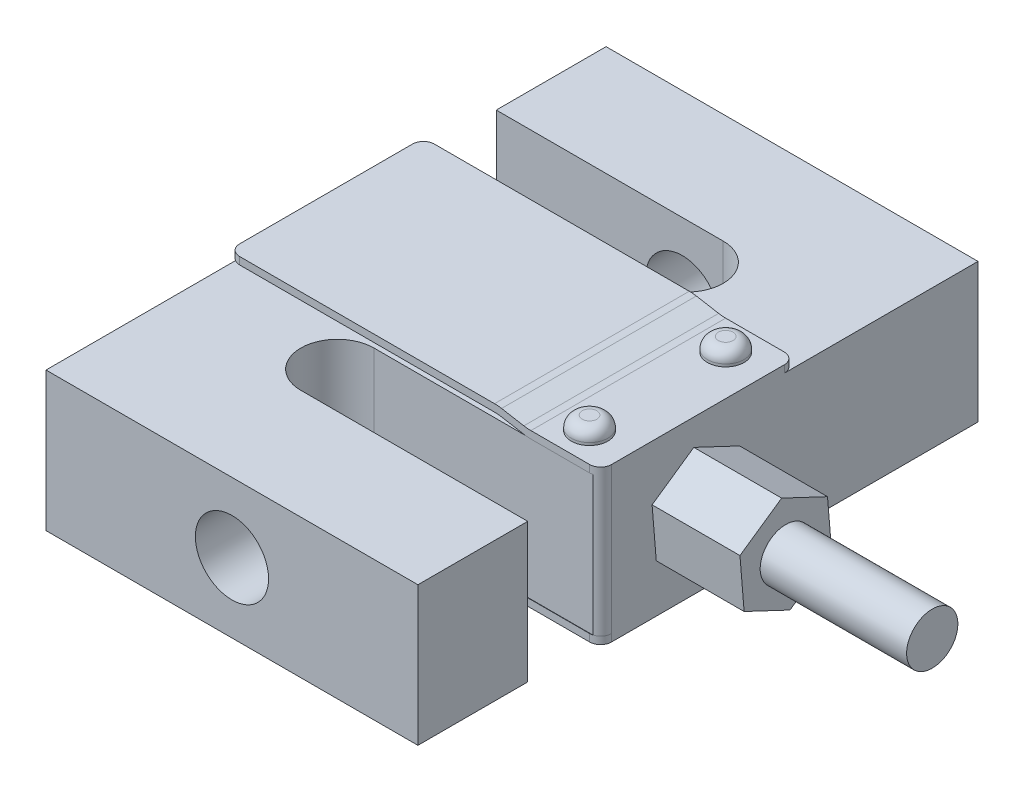
from build123d import *

# Parameters (mm, degrees)
SALIENTE_EXTRUIR1_DEPTH = 19
CORTAR_EXTRUIR1_REACH   = 84.816
CROQUIS2_R              = 5
CORTAR_EXTRUIR2_REACH   = 84.816
CROQUIS3_R              = 5
SALIENTE_EXTRUIR2_DEPTH = 12
CROQUIS5_R              = 3.5
SALIENTE_EXTRUIR3_DEPTH = 20
SALIENTE_EXTRUIR4_DEPTH = 13.3
REDONDEO1_R             = 1.5
CROQUIS8_R              = 2.5
SALIENTE_EXTRUIR5_DEPTH = 1.85
REDONDEO2_R             = 1.5
SIMETR_A1_START         = -1.3500001
SIMETR_A1_OUTLINE_R     = 2.5
SIMETR_A1_DEPTH         = 1.3500001
SIMETR_A1_START_2       = -13.3
SIMETR_A1_2_DEPTH       = 26.6
SIMETR_A1_START_3       = -3
SIMETR_A1_5_DEPTH       = 3


with BuildPart() as part:
    # Croquis1 → Saliente-Extruir1 (new body)
    with BuildSketch(Plane(origin=(0, 0, 0), x_dir=(1, 0, 0), z_dir=(0, 1, 0))):
        with BuildLine():
            Line((-25.4, 23.25), (-25.4, 38.25))
            Line((-25.4, 38.25), (25.4, 38.25))
            Line((25.4, 38.25), (25.4, -13.25))
            Line((25.4, -13.25), (-5.6, -13.25))
            ThreePointArc((-5.6, -13.25), (-10.6, -18.25), (-5.6, -23.25))
            Line((-5.6, -23.25), (25.4, -23.25))
            Line((25.4, -23.25), (25.4, -38.25))
            Line((25.4, -38.25), (-25.4, -38.25))
            Line((-25.4, -38.25), (-25.4, 13.25))
            Line((-25.4, 13.25), (5.6, 13.25))
            ThreePointArc((5.6, 13.25), (10.6, 18.25), (5.6, 23.25))
            Line((5.6, 23.25), (-25.4, 23.25))
        make_face()
    extrude(amount=SALIENTE_EXTRUIR1_DEPTH)

    # Croquis2 → Cortar-Extruir1 (cut, up to next)
    with BuildSketch(Plane(origin=(0, 0, -38.25), x_dir=(-1, 0, 0), z_dir=(0, 0, -1)), mode=Mode.PRIVATE) as cortar_extruir1_sk1:
        with Locations((0, 9.5)):
            Circle(CROQUIS2_R)
    cortar_extruir1_tool1 = extrude(cortar_extruir1_sk1.sketch, amount=-CORTAR_EXTRUIR1_REACH, mode=Mode.PRIVATE) & part.part
    add(cortar_extruir1_tool1.solids().sort_by_distance((0, 9.5, -38.25))[0], mode=Mode.SUBTRACT)

    # Croquis3 → Cortar-Extruir2 (cut, up to next)
    with BuildSketch(Plane.XY.offset(38.25), mode=Mode.PRIVATE) as cortar_extruir2_sk1:
        with Locations(Location((0, 9.5, 0), (0, 0, 180))):
            Circle(CROQUIS3_R)
    cortar_extruir2_tool1 = extrude(cortar_extruir2_sk1.sketch, amount=-CORTAR_EXTRUIR2_REACH, mode=Mode.PRIVATE) & part.part
    add(cortar_extruir2_tool1.solids().sort_by_distance((0, 9.5, 38.25))[0], mode=Mode.SUBTRACT)

    # Croquis4 → Saliente-Extruir2 (add)
    with BuildSketch(Plane(origin=(25.4, 0, 0), x_dir=(0, 0, -1), z_dir=(1, 0, 0))):
        Polygon((0.567837029, 2.595106003), (6.263732126, 6.539314294), (5.695895097, 13.444208291), (-0.567837029, 16.404893997), (-6.263732126, 12.460685706), (-5.695895097, 5.555791709), align=None)
    extrude(amount=SALIENTE_EXTRUIR2_DEPTH)

    # Croquis5 → Saliente-Extruir3 (add)
    with BuildSketch(Plane(origin=(37.4, 0, 0), x_dir=(0, 0, -1), z_dir=(1, 0, 0))):
        with Locations((0, 9.5)):
            Circle(CROQUIS5_R)
    extrude(amount=SALIENTE_EXTRUIR3_DEPTH)

    # Croquis6 → Saliente-Extruir4 (add, symmetric)
    with BuildSketch(Plane.XY):
        with BuildLine():
            Line((25.4, 19), (15.884301947, 19))
            ThreePointArc((15.884301947, 19), (15.401815848, 19.020910233), (14.922947827, 19.08348413))
            Line((14.922947827, 19.08348413), (11.877052173, 19.61651587))
            ThreePointArc((11.877052173, 19.61651587), (11.398184152, 19.679089767), (10.915698053, 19.7))
            Line((10.915698053, 19.7), (-25.4, 19.7))
            Line((-25.4, 19.7), (-25.4, 20.7))
            Line((-25.4, 20.7), (10.915698053, 20.7))
            ThreePointArc((10.915698053, 20.7), (11.398184152, 20.679089767), (11.877052173, 20.61651587))
            Line((11.877052173, 20.61651587), (14.922947827, 20.08348413))
            ThreePointArc((14.922947827, 20.08348413), (15.401815848, 20.020910233), (15.884301947, 20))
            Line((15.884301947, 20), (25.4, 20))
            Line((25.4, 20), (25.4, 19))
        make_face()
    extrude(amount=SALIENTE_EXTRUIR4_DEPTH, both=True)

    # Redondeo1
    redondeo1_edges = [part.edges().sort_by_distance(p)[0] for p in [
        (-25.4, 20.2, -13.3),
        (-25.4, 20.2, 13.3),
        (25.4, 19.5, 13.3),
        (25.4, 19.5, -13.3),
    ]]
    fillet(redondeo1_edges, radius=REDONDEO1_R)

    # Croquis8 → Saliente-Extruir5 (add)
    with BuildSketch(Plane(origin=(0, 20, 0), x_dir=(1, 0, 0), z_dir=(0, 1, 0))):
        with Locations(Location((19.892150974, 9.3, 0), (0, 0, 180))):
            Circle(CROQUIS8_R)
        with Locations(Location((19.892150974, -9.3, 0), (0, 0, 180))):
            Circle(CROQUIS8_R)
    extrude(amount=SALIENTE_EXTRUIR5_DEPTH)

    # Redondeo2
    redondeo2_edges = [part.edges().sort_by_distance(p)[0] for p in [
        (22.392150974, 21.85, -9.3),
        (22.392150974, 21.85, 9.3),
    ]]
    fillet(redondeo2_edges, radius=REDONDEO2_R)

    # Simetría1: read off the stored shape, not the designer's step
    # Simetría1 outline → Simetría1 (add)
    with BuildSketch(Plane(origin=(0, 0, 0), x_dir=(1, 0, 0), z_dir=(0, 1, 0)).offset(SIMETR_A1_START)):
        with Locations((19.892150974, 9.3)):
            Circle(SIMETR_A1_OUTLINE_R)
        with Locations((19.892150974, -9.3)):
            Circle(SIMETR_A1_OUTLINE_R)
    extrude(amount=SIMETR_A1_DEPTH)

    # Simetr_a1 2 outline → Simetr_a1 2 (add)
    with BuildSketch(Plane.XY.offset(SIMETR_A1_START_2)):
        with BuildLine():
            Line((-25.4, -0.7), (-25.4, -1.7))
            Line((-25.4, -1.7), (10.915698053, -1.7))
            ThreePointArc((10.915698053, -1.7), (11.398184152, -1.679089767), (11.877052173, -1.61651587))
            Line((11.877052173, -1.61651587), (14.922947827, -1.08348413))
            ThreePointArc((14.922947827, -1.08348413), (15.401815848, -1.020910233), (15.884301947, -1))
            Line((15.884301947, -1), (25.4, -1))
            Line((25.4, -1), (25.4, 0))
            Line((25.4, 0), (15.884301947, 0))
            ThreePointArc((15.884301947, 0), (15.401815848, -0.020910233), (14.922947827, -0.08348413))
            Line((14.922947827, -0.08348413), (11.877052173, -0.61651587))
            ThreePointArc((11.877052173, -0.61651587), (11.398184152, -0.679089767), (10.915698053, -0.7))
            Line((10.915698053, -0.7), (-25.4, -0.7))
        make_face()
    extrude(amount=SIMETR_A1_2_DEPTH)

    # Simetr_a1 3 outline → Simetr_a1 3 (revolve)
    with BuildSketch(Plane(origin=(19.892150974, 0, -9.3), x_dir=(1, 0, 0), z_dir=(0, 0, 1))):
        with BuildLine():
            Line((0, -1.35), (0, -2.85))
            Line((0, -2.85), (1, -2.85))
            ThreePointArc((1, -2.85), (2.060660172, -2.410660172), (2.5, -1.35))
            Line((2.5, -1.35), (0, -1.35))
        make_face()
    revolve(axis=Axis((19.892150974, 0, -9.3), (0, 1, 0)))

    # Simetr_a1 4 outline → Simetr_a1 4 (revolve)
    with BuildSketch(Plane(origin=(19.892150974, 0, 9.3), x_dir=(1, 0, 0), z_dir=(0, 0, 1))):
        with BuildLine():
            Line((0, -1.35), (0, -2.85))
            Line((0, -2.85), (1, -2.85))
            ThreePointArc((1, -2.85), (2.060660172, -2.410660172), (2.5, -1.35))
            Line((2.5, -1.35), (0, -1.35))
        make_face()
    revolve(axis=Axis((19.892150974, 0, 9.3), (0, 1, 0)))

    # Simetr_a1 5 outline → Simetr_a1 5 (cut)
    with BuildSketch(Plane(origin=(0, 0, 0), x_dir=(1, 0, 0), z_dir=(0, 1, 0)).offset(SIMETR_A1_START_3)):
        with BuildLine():
            ThreePointArc((-25.4, 11.8), (-24.960660172, 12.860660172), (-23.9, 13.3))
            Line((-23.9, 13.3), (-25.4, 13.3))
            Line((-25.4, 13.3), (-25.4, 11.8))
        make_face()
        with BuildLine():
            Line((25.4, 13.3), (23.9, 13.3))
            ThreePointArc((23.9, 13.3), (24.960660172, 12.860660172), (25.4, 11.8))
            Line((25.4, 11.8), (25.4, 13.3))
        make_face()
        with BuildLine():
            ThreePointArc((-23.9, -13.3), (-24.960660172, -12.860660172), (-25.4, -11.8))
            Line((-25.4, -11.8), (-25.4, -13.3))
            Line((-25.4, -13.3), (-23.9, -13.3))
        make_face()
        with BuildLine():
            Line((25.4, -13.3), (25.4, -11.8))
            ThreePointArc((25.4, -11.8), (24.960660172, -12.860660172), (23.9, -13.3))
            Line((23.9, -13.3), (25.4, -13.3))
        make_face()
    extrude(amount=SIMETR_A1_5_DEPTH, mode=Mode.SUBTRACT)


solid = part.part
